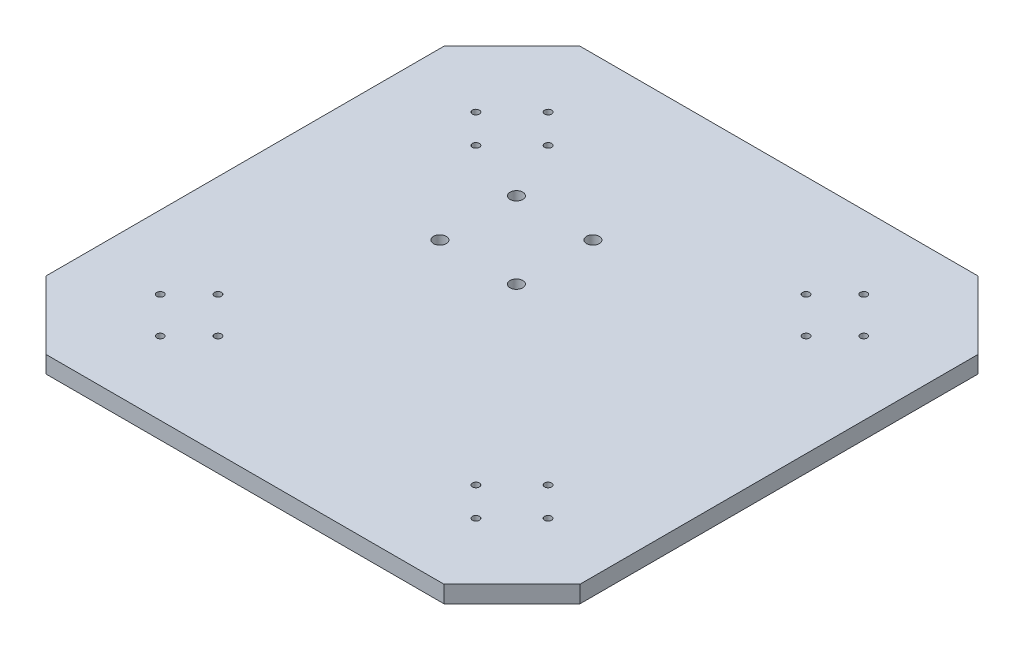
from build123d import *

# Parameters (mm, degrees)
BOSS_EXTRUDE1_DEPTH = 10
CUT_EXTRUDE1_REACH  = 179.059
SKETCH2_R           = 2.05
BOSS_EXTRUDE2_DEPTH = 10
BOSS_EXTRUDE3_DEPTH = 10
SKETCH5_R           = 3.5
CUT_EXTRUDE2_DEPTH  = 4
SKETCH6_R           = 3.75
CUT_EXTRUDE4_DEPTH  = 223.256608451


# Read off the part's stored shape, not the designer's step: moBlkMgr[DitRB1]
with BuildPart() as part:
    # Sketch1 → Boss-Extrude1 (new body)
    with BuildSketch(Plane(origin=(0, 0, 0), x_dir=(1, 0, 0), z_dir=(0, 1, 0))):
        Polygon((-96.715728753, 125), (-125, 96.715728753), (-125, -96.715728753), (-96.715728753, -125), (96.715728753, -125), (125, -96.715728753), (125, 96.715728753), (96.715728753, 125), align=None)
    extrude(amount=BOSS_EXTRUDE1_DEPTH)

    # Sketch2 → Cut-Extrude1 (cut, up to next)
    with BuildSketch(Plane(origin=(0, 10, 0), x_dir=(1, 0, 0), z_dir=(0, 1, 0)), mode=Mode.PRIVATE) as cut_extrude1_sk1:
        with Locations(Location((-97.069282143, -75.856078708, 0), (0, 0, 270))):
            Circle(SKETCH2_R)
    cut_extrude1_tool1 = extrude(cut_extrude1_sk1.sketch, amount=-CUT_EXTRUDE1_REACH, mode=Mode.PRIVATE) & part.part
    # Sketch2 → Cut-Extrude1 (cut, up to next)
    with BuildSketch(Plane(origin=(0, 10, 0), x_dir=(1, 0, 0), z_dir=(0, 1, 0)), mode=Mode.PRIVATE) as cut_extrude1_sk2:
        with Locations(Location((-114.039844892, -92.826641456, 0), (0, 0, 270))):
            Circle(SKETCH2_R)
    cut_extrude1_tool2 = extrude(cut_extrude1_sk2.sketch, amount=-CUT_EXTRUDE1_REACH, mode=Mode.PRIVATE) & part.part
    # Sketch2 → Cut-Extrude1 (cut, up to next)
    with BuildSketch(Plane(origin=(0, 10, 0), x_dir=(1, 0, 0), z_dir=(0, 1, 0)), mode=Mode.PRIVATE) as cut_extrude1_sk3:
        with Locations(Location((-75.856078708, -97.069282143, 0), (0, 0, 90))):
            Circle(SKETCH2_R)
    cut_extrude1_tool3 = extrude(cut_extrude1_sk3.sketch, amount=-CUT_EXTRUDE1_REACH, mode=Mode.PRIVATE) & part.part
    # Sketch2 → Cut-Extrude1 (cut, up to next)
    with BuildSketch(Plane(origin=(0, 10, 0), x_dir=(1, 0, 0), z_dir=(0, 1, 0)), mode=Mode.PRIVATE) as cut_extrude1_sk4:
        with Locations(Location((-92.826641456, -114.039844892, 0), (0, 0, 90))):
            Circle(SKETCH2_R)
    cut_extrude1_tool4 = extrude(cut_extrude1_sk4.sketch, amount=-CUT_EXTRUDE1_REACH, mode=Mode.PRIVATE) & part.part
    # Sketch2 → Cut-Extrude1 (cut, up to next)
    with BuildSketch(Plane(origin=(0, 10, 0), x_dir=(1, 0, 0), z_dir=(0, 1, 0)), mode=Mode.PRIVATE) as cut_extrude1_sk5:
        with Locations(Location((-75.856078708, 97.069282143, 0), (0, 0, 270))):
            Circle(SKETCH2_R)
    cut_extrude1_tool5 = extrude(cut_extrude1_sk5.sketch, amount=-CUT_EXTRUDE1_REACH, mode=Mode.PRIVATE) & part.part
    # Sketch2 → Cut-Extrude1 (cut, up to next)
    with BuildSketch(Plane(origin=(0, 10, 0), x_dir=(1, 0, 0), z_dir=(0, 1, 0)), mode=Mode.PRIVATE) as cut_extrude1_sk6:
        with Locations(Location((-92.826641456, 114.039844892, 0), (0, 0, 270))):
            Circle(SKETCH2_R)
    cut_extrude1_tool6 = extrude(cut_extrude1_sk6.sketch, amount=-CUT_EXTRUDE1_REACH, mode=Mode.PRIVATE) & part.part
    # Sketch2 → Cut-Extrude1 (cut, up to next)
    with BuildSketch(Plane(origin=(0, 10, 0), x_dir=(1, 0, 0), z_dir=(0, 1, 0)), mode=Mode.PRIVATE) as cut_extrude1_sk7:
        with Locations(Location((-114.039844892, 92.826641456, 0), (0, 0, 90))):
            Circle(SKETCH2_R)
    cut_extrude1_tool7 = extrude(cut_extrude1_sk7.sketch, amount=-CUT_EXTRUDE1_REACH, mode=Mode.PRIVATE) & part.part
    # Sketch2 → Cut-Extrude1 (cut, up to next)
    with BuildSketch(Plane(origin=(0, 10, 0), x_dir=(1, 0, 0), z_dir=(0, 1, 0)), mode=Mode.PRIVATE) as cut_extrude1_sk8:
        with Locations(Location((-97.069282143, 75.856078708, 0), (0, 0, 90))):
            Circle(SKETCH2_R)
    cut_extrude1_tool8 = extrude(cut_extrude1_sk8.sketch, amount=-CUT_EXTRUDE1_REACH, mode=Mode.PRIVATE) & part.part
    # Sketch2 → Cut-Extrude1 (cut, up to next)
    with BuildSketch(Plane(origin=(0, 10, 0), x_dir=(1, 0, 0), z_dir=(0, 1, 0)), mode=Mode.PRIVATE) as cut_extrude1_sk9:
        with Locations(Location((97.069282143, 75.856078708, 0), (0, 0, 270))):
            Circle(SKETCH2_R)
    cut_extrude1_tool9 = extrude(cut_extrude1_sk9.sketch, amount=-CUT_EXTRUDE1_REACH, mode=Mode.PRIVATE) & part.part
    # Sketch2 → Cut-Extrude1 (cut, up to next)
    with BuildSketch(Plane(origin=(0, 10, 0), x_dir=(1, 0, 0), z_dir=(0, 1, 0)), mode=Mode.PRIVATE) as cut_extrude1_sk10:
        with Locations(Location((114.039844892, 92.826641456, 0), (0, 0, 270))):
            Circle(SKETCH2_R)
    cut_extrude1_tool10 = extrude(cut_extrude1_sk10.sketch, amount=-CUT_EXTRUDE1_REACH, mode=Mode.PRIVATE) & part.part
    # Sketch2 → Cut-Extrude1 (cut, up to next)
    with BuildSketch(Plane(origin=(0, 10, 0), x_dir=(1, 0, 0), z_dir=(0, 1, 0)), mode=Mode.PRIVATE) as cut_extrude1_sk11:
        with Locations(Location((92.826641456, 114.039844892, 0), (0, 0, 90))):
            Circle(SKETCH2_R)
    cut_extrude1_tool11 = extrude(cut_extrude1_sk11.sketch, amount=-CUT_EXTRUDE1_REACH, mode=Mode.PRIVATE) & part.part
    # Sketch2 → Cut-Extrude1 (cut, up to next)
    with BuildSketch(Plane(origin=(0, 10, 0), x_dir=(1, 0, 0), z_dir=(0, 1, 0)), mode=Mode.PRIVATE) as cut_extrude1_sk12:
        with Locations(Location((75.856078708, 97.069282143, 0), (0, 0, 90))):
            Circle(SKETCH2_R)
    cut_extrude1_tool12 = extrude(cut_extrude1_sk12.sketch, amount=-CUT_EXTRUDE1_REACH, mode=Mode.PRIVATE) & part.part
    # Sketch2 → Cut-Extrude1 (cut, up to next)
    with BuildSketch(Plane(origin=(0, 10, 0), x_dir=(1, 0, 0), z_dir=(0, 1, 0)), mode=Mode.PRIVATE) as cut_extrude1_sk13:
        with Locations(Location((75.856078708, -97.069282143, 0), (0, 0, 270))):
            Circle(SKETCH2_R)
    cut_extrude1_tool13 = extrude(cut_extrude1_sk13.sketch, amount=-CUT_EXTRUDE1_REACH, mode=Mode.PRIVATE) & part.part
    # Sketch2 → Cut-Extrude1 (cut, up to next)
    with BuildSketch(Plane(origin=(0, 10, 0), x_dir=(1, 0, 0), z_dir=(0, 1, 0)), mode=Mode.PRIVATE) as cut_extrude1_sk14:
        with Locations(Location((92.826641456, -114.039844892, 0), (0, 0, 270))):
            Circle(SKETCH2_R)
    cut_extrude1_tool14 = extrude(cut_extrude1_sk14.sketch, amount=-CUT_EXTRUDE1_REACH, mode=Mode.PRIVATE) & part.part
    # Sketch2 → Cut-Extrude1 (cut, up to next)
    with BuildSketch(Plane(origin=(0, 10, 0), x_dir=(1, 0, 0), z_dir=(0, 1, 0)), mode=Mode.PRIVATE) as cut_extrude1_sk15:
        with Locations(Location((114.039844892, -92.826641456, 0), (0, 0, 90))):
            Circle(SKETCH2_R)
    cut_extrude1_tool15 = extrude(cut_extrude1_sk15.sketch, amount=-CUT_EXTRUDE1_REACH, mode=Mode.PRIVATE) & part.part
    # Sketch2 → Cut-Extrude1 (cut, up to next)
    with BuildSketch(Plane(origin=(0, 10, 0), x_dir=(1, 0, 0), z_dir=(0, 1, 0)), mode=Mode.PRIVATE) as cut_extrude1_sk16:
        with Locations(Location((97.069282143, -75.856078708, 0), (0, 0, 90))):
            Circle(SKETCH2_R)
    cut_extrude1_tool16 = extrude(cut_extrude1_sk16.sketch, amount=-CUT_EXTRUDE1_REACH, mode=Mode.PRIVATE) & part.part
    add(cut_extrude1_tool1.solids().sort_by_distance((-97.069282, 10, 75.856079))[0], mode=Mode.SUBTRACT)
    add(cut_extrude1_tool2.solids().sort_by_distance((-114.039845, 10, 92.826641))[0], mode=Mode.SUBTRACT)
    add(cut_extrude1_tool3.solids().sort_by_distance((-75.856079, 10, 97.069282))[0], mode=Mode.SUBTRACT)
    add(cut_extrude1_tool4.solids().sort_by_distance((-92.826641, 10, 114.039845))[0], mode=Mode.SUBTRACT)
    add(cut_extrude1_tool5.solids().sort_by_distance((-75.856079, 10, -97.069282))[0], mode=Mode.SUBTRACT)
    add(cut_extrude1_tool6.solids().sort_by_distance((-92.826641, 10, -114.039845))[0], mode=Mode.SUBTRACT)
    add(cut_extrude1_tool7.solids().sort_by_distance((-114.039845, 10, -92.826641))[0], mode=Mode.SUBTRACT)
    add(cut_extrude1_tool8.solids().sort_by_distance((-97.069282, 10, -75.856079))[0], mode=Mode.SUBTRACT)
    add(cut_extrude1_tool9.solids().sort_by_distance((97.069282, 10, -75.856079))[0], mode=Mode.SUBTRACT)
    add(cut_extrude1_tool10.solids().sort_by_distance((114.039845, 10, -92.826641))[0], mode=Mode.SUBTRACT)
    add(cut_extrude1_tool11.solids().sort_by_distance((92.826641, 10, -114.039845))[0], mode=Mode.SUBTRACT)
    add(cut_extrude1_tool12.solids().sort_by_distance((75.856079, 10, -97.069282))[0], mode=Mode.SUBTRACT)
    add(cut_extrude1_tool13.solids().sort_by_distance((75.856079, 10, 97.069282))[0], mode=Mode.SUBTRACT)
    add(cut_extrude1_tool14.solids().sort_by_distance((92.826641, 10, 114.039845))[0], mode=Mode.SUBTRACT)
    add(cut_extrude1_tool15.solids().sort_by_distance((114.039845, 10, 92.826641))[0], mode=Mode.SUBTRACT)
    add(cut_extrude1_tool16.solids().sort_by_distance((97.069282, 10, 75.856079))[0], mode=Mode.SUBTRACT)

    # Sketch3 → Boss-Extrude2 (add)
    with BuildSketch(Plane(origin=(0, 10, 0), x_dir=(1, 0, 0), z_dir=(0, 1, 0))):
        Polygon((-125, 96.715728753), (-157, 64.715728753), (-157, -64.715728753), (-125, -96.715728753), align=None)
        Polygon((64.715728753, 157), (-64.715728753, 157), (-96.715728753, 125), (96.715728753, 125), align=None)
        Polygon((157, -64.715728753), (157, 64.715728753), (125, 96.715728753), (125, -96.715728753), align=None)
        Polygon((-64.715728753, -157), (64.715728753, -157), (96.715728753, -125), (-96.715728753, -125), align=None)
    extrude(amount=-BOSS_EXTRUDE2_DEPTH)

    # Sketch4 → Boss-Extrude3 (add)
    with BuildSketch(Plane(origin=(0, 10, 0), x_dir=(1, 0, 0), z_dir=(0, 1, 0))):
        Polygon((-157, 64.715728753), (-64.715728753, 157), (-117.04163056, 157), (-157, 117.04163056), align=None)
        Polygon((64.715728753, 157), (157, 64.715728753), (157, 117.04163056), (117.04163056, 157), align=None)
        Polygon((157, -64.715728753), (64.715728753, -157), (117.04163056, -157), (157, -117.04163056), align=None)
        Polygon((-64.715728753, -157), (-157, -64.715728753), (-157, -117.04163056), (-117.04163056, -157), align=None)
    extrude(amount=-BOSS_EXTRUDE3_DEPTH)

    # Sketch5 → Cut-Extrude2 (cut)
    with BuildSketch(Plane.XZ):
        with Locations(Location((-114.039844892, 92.826641456, 0), (0, 0, 270))):
            Circle(SKETCH5_R)
        with Locations(Location((-92.826641456, 114.039844892, 0), (0, 0, 270))):
            Circle(SKETCH5_R)
        with Locations(Location((-75.856078708, 97.069282143, 0), (0, 0, 270))):
            Circle(SKETCH5_R)
        with Locations(Location((-97.069282143, 75.856078708, 0), (0, 0, 270))):
            Circle(SKETCH5_R)
        with Locations(Location((114.039844892, 92.826641456, 0), (0, 0, 270))):
            Circle(SKETCH5_R)
        with Locations(Location((92.826641456, 114.039844892, 0), (0, 0, 270))):
            Circle(SKETCH5_R)
        with Locations(Location((75.856078708, 97.069282143, 0), (0, 0, 270))):
            Circle(SKETCH5_R)
        with Locations(Location((97.069282143, 75.856078708, 0), (0, 0, 270))):
            Circle(SKETCH5_R)
        with Locations(Location((92.826641456, -114.039844892, 0), (0, 0, 270))):
            Circle(SKETCH5_R)
        with Locations(Location((114.039844892, -92.826641456, 0), (0, 0, 270))):
            Circle(SKETCH5_R)
        with Locations(Location((97.069282143, -75.856078708, 0), (0, 0, 270))):
            Circle(SKETCH5_R)
        with Locations(Location((75.856078708, -97.069282143, 0), (0, 0, 270))):
            Circle(SKETCH5_R)
        with Locations(Location((-114.039844892, -92.826641456, 0), (0, 0, 270))):
            Circle(SKETCH5_R)
        with Locations(Location((-92.826641456, -114.039844892, 0), (0, 0, 270))):
            Circle(SKETCH5_R)
        with Locations(Location((-75.856078708, -97.069282143, 0), (0, 0, 270))):
            Circle(SKETCH5_R)
        with Locations(Location((-97.069282143, -75.856078708, 0), (0, 0, 270))):
            Circle(SKETCH5_R)
    extrude(amount=-CUT_EXTRUDE2_DEPTH, mode=Mode.SUBTRACT)

    # Sketch6 → Cut-Extrude4 (cut, through all)
    with BuildSketch(Plane.XZ):
        with Locations(Location((-59.5, -17.1, 0), (0, 0, 270))):
            Circle(SKETCH6_R)
        with Locations(Location((-14.5, -17.1, 0), (0, 0, 270))):
            Circle(SKETCH6_R)
        with Locations(Location((-14.5, -62.1, 0), (0, 0, 270))):
            Circle(SKETCH6_R)
        with Locations(Location((-59.5, -62.1, 0), (0, 0, 270))):
            Circle(SKETCH6_R)
    extrude(amount=-CUT_EXTRUDE4_DEPTH, mode=Mode.SUBTRACT)


solid = part.part
